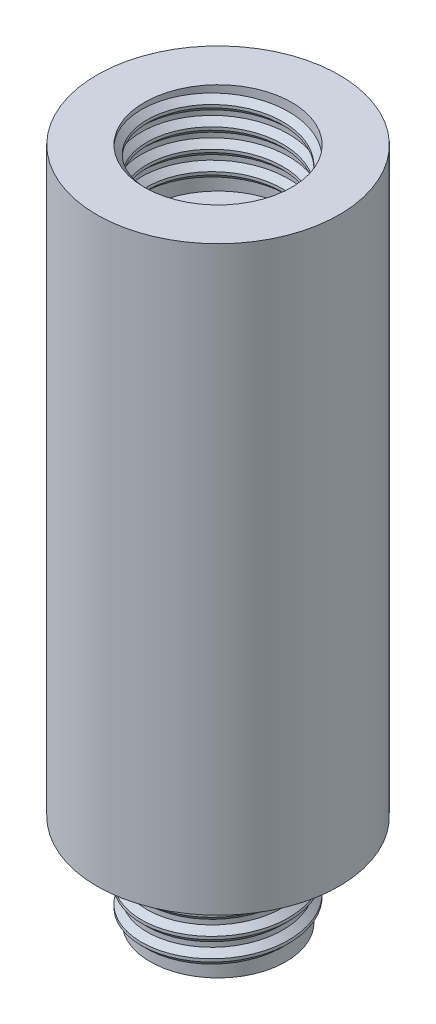
from build123d import *

# Parameters (mm, degrees)
SKETCH_1_R          = 12.5
EXTRUDE_1_DEPTH     = 60
SKETCH_14_R         = 7.6
CUT_EXTRUDE_1_DEPTH = 9.5
SKETCH_10_R         = 7
EXTRUDE_2_DEPTH     = 9.5
SWEEP_1_PITCH       = 2
SWEEP_2_PITCH       = 2


with BuildPart() as part:
    # 草图1 → 凸台-拉伸1 (new body)
    with BuildSketch(Plane(origin=(0, 0, 0), x_dir=(1, 0, 0), z_dir=(0, 1, 0))):
        with Locations(Location((0, 0, 0), (0, 0, 270))):
            Circle(SKETCH_1_R)
    extrude(amount=EXTRUDE_1_DEPTH)

    # 草图14 → 切除-拉伸1 (cut)
    with BuildSketch(Plane(origin=(0, 60, 0), x_dir=(1, 0, 0), z_dir=(0, 1, 0))):
        with Locations(Location((0, 0, 0), (0, 0, 270))):
            Circle(SKETCH_14_R)
    extrude(amount=-CUT_EXTRUDE_1_DEPTH, mode=Mode.SUBTRACT)

    # 草图10 → 凸台-拉伸2 (add)
    with BuildSketch(Plane.XZ):
        with Locations(Location((0, 0, 0), (0, 0, 270))):
            Circle(SKETCH_10_R)
    extrude(amount=EXTRUDE_2_DEPTH)

    # 扫描1: arcs per turn and ends read off the stored shape
    # 扫描1: the profile of 草图17 profile screwed along a right-hand helix through 4 turns, 10 arcs to a turn; built about Z, then put on its axis
    sweep_1_z = Axis((0, 0, 0), (0, 0, 1))
    sweep_1_corners = [(6.9997, 0, -0.7503), (6.9997, 0, 0.7503), (7.6, 0, 0.15), (7.6, 0, -0.15)]
    with BuildLine(mode=Mode.PRIVATE) as sweep_1_profile:
        Line(sweep_1_corners[0], sweep_1_corners[1])
        Line(sweep_1_corners[1], sweep_1_corners[2])
        Line(sweep_1_corners[2], sweep_1_corners[3])
        Line(sweep_1_corners[3], sweep_1_corners[0])
    sweep_1_cap = Face(sweep_1_profile.wire())
    sweep_1_turn_angles = [0, 18, 36, 54, 72, 90, 108, 126, 144, 162, 180, 198, 216, 234, 252, 270, 288, 306, 324, 342, 360]
    sweep_1_turn_weights = [1, 0.9510565162951535, 1, 0.9510565162951535, 1, 0.9510565162951535, 1, 0.9510565162951535, 1, 0.9510565162951535, 1, 0.9510565162951535, 1, 0.9510565162951535, 1, 0.9510565162951535, 1, 0.9510565162951535, 1, 0.9510565162951535, 1]
    sweep_1_turn_rails = [Edge.make_bspline([Vector(p[0], p[1], 0).rotate(sweep_1_z, sweep_1_turn_angles[k]) / sweep_1_turn_weights[k] + Vector(0, 0, p[2] + SWEEP_1_PITCH * sweep_1_turn_angles[k] / 360) for k in range(21)], [0, 0, 0, 1, 1, 2, 2, 3, 3, 4, 4, 5, 5, 6, 6, 7, 7, 8, 8, 9, 9, 10, 10, 10], 2, sweep_1_turn_weights) for p in sweep_1_corners]
    sweep_1_turn_sides = [Face.make_surface_from_curves(sweep_1_turn_rails[p[0]], sweep_1_turn_rails[p[1]]) for p in [(0, 1), (1, 2), (2, 3), (3, 0)]]
    sweep_1 = Plane(origin=(0, -0.75, 0), x_dir=(0, 0, -1), z_dir=(0, -1, 0)) * Solid(Shell([*[p.moved(Location((0, 0, SWEEP_1_PITCH * i))) for i in range(4) for p in sweep_1_turn_sides], sweep_1_cap, sweep_1_cap.rotate(sweep_1_z, 1440).moved(Location((0, 0, SWEEP_1_PITCH * 1440 / 360)))]))
    add(sweep_1)

    # 扫描2: arcs per turn and ends read off the stored shape
    # 扫描2: the profile of 草图19 profile screwed along a right-hand helix through 4 turns, 10 arcs to a turn; built about Z, then put on its axis
    sweep_2_z = Axis((0, 0, 0), (0, 0, 1))
    sweep_2_corners = [(7.6003, 0, -0.7503), (7.6003, 0, 0.7503), (7, 0, 0.15), (7, 0, -0.15)]
    with BuildLine(mode=Mode.PRIVATE) as sweep_2_profile:
        Line(sweep_2_corners[0], sweep_2_corners[1])
        Line(sweep_2_corners[1], sweep_2_corners[2])
        Line(sweep_2_corners[2], sweep_2_corners[3])
        Line(sweep_2_corners[3], sweep_2_corners[0])
    sweep_2_cap = Face(sweep_2_profile.wire())
    sweep_2_turn_angles = [0, 18, 36, 54, 72, 90, 108, 126, 144, 162, 180, 198, 216, 234, 252, 270, 288, 306, 324, 342, 360]
    sweep_2_turn_weights = [1, 0.9510565162951535, 1, 0.9510565162951535, 1, 0.9510565162951535, 1, 0.9510565162951535, 1, 0.9510565162951535, 1, 0.9510565162951535, 1, 0.9510565162951535, 1, 0.9510565162951535, 1, 0.9510565162951535, 1, 0.9510565162951535, 1]
    sweep_2_turn_rails = [Edge.make_bspline([Vector(p[0], p[1], 0).rotate(sweep_2_z, sweep_2_turn_angles[k]) / sweep_2_turn_weights[k] + Vector(0, 0, p[2] + SWEEP_2_PITCH * sweep_2_turn_angles[k] / 360) for k in range(21)], [0, 0, 0, 1, 1, 2, 2, 3, 3, 4, 4, 5, 5, 6, 6, 7, 7, 8, 8, 9, 9, 10, 10, 10], 2, sweep_2_turn_weights) for p in sweep_2_corners]
    sweep_2_turn_sides = [Face.make_surface_from_curves(sweep_2_turn_rails[p[0]], sweep_2_turn_rails[p[1]]) for p in [(0, 1), (1, 2), (2, 3), (3, 0)]]
    sweep_2 = Plane(origin=(0, 59.25, 0), x_dir=(0, 0, 1), z_dir=(0, -1, 0)) * Solid(Shell([*[p.moved(Location((0, 0, SWEEP_2_PITCH * i))) for i in range(4) for p in sweep_2_turn_sides], sweep_2_cap, sweep_2_cap.rotate(sweep_2_z, 1440).moved(Location((0, 0, SWEEP_2_PITCH * 1440 / 360)))]))
    add(sweep_2)


solid = part.part
